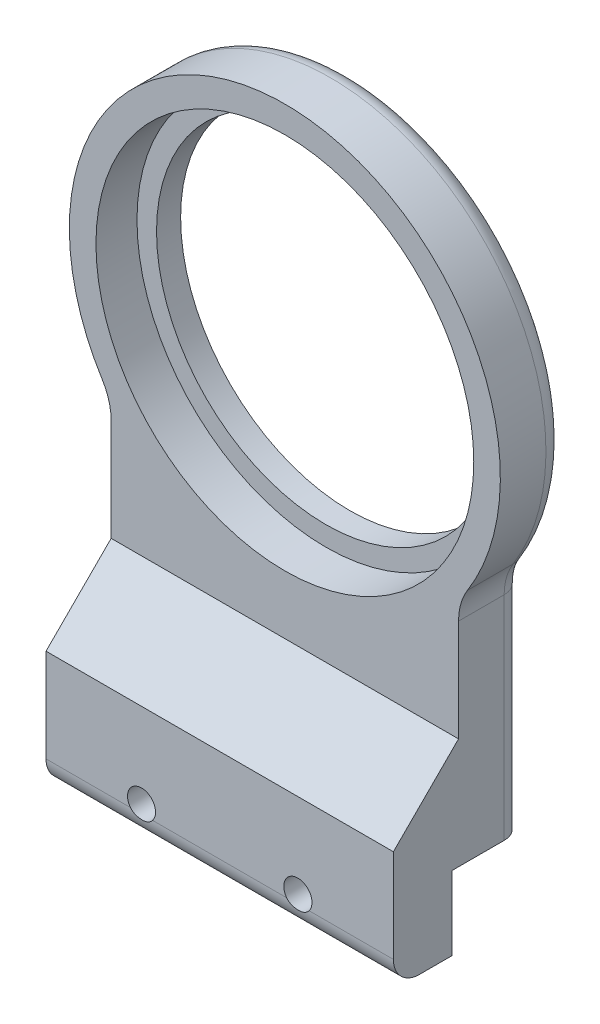
from build123d import *

# Parameters (mm, degrees)
SKETCH_1_R          = 26
EXTRUDE_1_DEPTH     = 10
SKETCH_3_R          = 29
CUT_EXTRUDE_1_DEPTH = 6.3
FILLET_1_R          = 9
SKETCH_4_W          = 53.328443722
SKETCH_4_H          = 11.316007496
EXTRUDE_2_DEPTH     = 10
SKETCH_5_W          = 53.328443722
SKETCH_5_H          = 11.316007496
EXTRUDE_3_DEPTH     = 2
SKETCH_6_W          = 53.328443722
SKETCH_6_H          = 10
EXTRUDE_4_DEPTH     = 3
CHAMFER_1_SIZE      = 14
FILLET_3_R          = 3
SKETCH_7_R          = 1.7
CUT_EXTRUDE_2_DEPTH = 14
SKETCH_8_R          = 2.15
SKETCH_8_R_2        = 2.165
CUT_EXTRUDE_3_DEPTH = 6
SKETCH_9_W          = 53.328443722
SKETCH_9_H          = 11.316007496
CUT_EXTRUDE_4_DEPTH = 3
FILLET_4_R          = 4


with BuildPart() as part:
    # 草图1 → 凸台-拉伸1 (new body)
    with BuildSketch(Plane.XY):
        with BuildLine():
            Line((26.664221861, -27.841996252), (-26.664221861, -27.841996252))
            Line((-26.664221861, -27.841996252), (-26.664221861, 7.574088737))
            ThreePointArc((-26.664221861, 7.574088737), (0, 60.241390131), (26.664221861, 7.574088737))
            Line((26.664221861, 7.574088737), (26.664221861, -27.841996252))
        make_face()
        with Locations((0, 27.158003748)):
            Circle(SKETCH_1_R, mode=Mode.SUBTRACT)
    extrude(amount=EXTRUDE_1_DEPTH)

    # 草图3 → 切除-拉伸1 (cut)
    with BuildSketch(Plane.XY.offset(10)):
        with Locations((0, 27.158003748)):
            Circle(SKETCH_3_R)
    extrude(amount=-CUT_EXTRUDE_1_DEPTH, mode=Mode.SUBTRACT)

    # 圆角1
    fillet_1_edges = [part.edges().sort_by_distance(p)[0] for p in [
        (-26.664221861, 7.574088737, 5),
        (26.664221861, 7.574088737, 5),
    ]]
    fillet(fillet_1_edges, radius=FILLET_1_R)



with BuildPart() as body_2:
    # 草图4 → 凸台-拉伸2 (new body)
    with BuildSketch(Plane.XY.offset(10)):
        with Locations((0, -33.5)):
            Rectangle(SKETCH_4_W, SKETCH_4_H)
    extrude(amount=EXTRUDE_2_DEPTH)


with BuildPart() as part_1:
    add(part.part)

    add(body_2.part)  # 凸台-拉伸3 merges body 2
    # 草图5 → 凸台-拉伸3 (add)
    with BuildSketch(Plane(origin=(0, 0, 10), x_dir=(-1, 0, 0), z_dir=(0, 0, -1))):
        with Locations((0, -33.5)):
            Rectangle(SKETCH_5_W, SKETCH_5_H)
    extrude(amount=EXTRUDE_3_DEPTH)

    # 草图6 → 凸台-拉伸4 (add)
    with BuildSketch(Plane(origin=(0, -27.841996252, 0), x_dir=(1, 0, 0), z_dir=(0, 1, 0))):
        with Locations((0, -15)):
            Rectangle(SKETCH_6_W, SKETCH_6_H)
    extrude(amount=EXTRUDE_4_DEPTH)

    # 倒角1
    # the kernel refuses this chamfer: 14 mm, written as the material it adds along each edge
    with BuildSketch(Plane(origin=(-26.664221861, -24.841996252, 10), x_dir=(0, -0.027495876610586365, 0.9996219169112968), z_dir=(1, 0, 0))) as chamfer_1_piece_1_section:
        Polygon((CHAMFER_1_SIZE * 0.999621916911, -CHAMFER_1_SIZE * 0.0274958766106), (-CHAMFER_1_SIZE * 0.0274958766106, -CHAMFER_1_SIZE * 0.999621916911), (0, 0), align=None)
    chamfer_1_piece_1 = extrude(amount=53.328443723, mode=Mode.PRIVATE)
    chamfer_1_piece_1 = split(chamfer_1_piece_1, bisect_by=Plane(origin=(0, -19.845516644, 20), z_dir=(0, 0, -1)), keep=Keep.TOP, mode=Mode.PRIVATE)
    add(chamfer_1_piece_1)

    # 圆角3
    fillet_3_edges = [part_1.edges().sort_by_distance(p)[0] for p in [
        (-26.664221861, -11.511986052, 0),
        (0, 60.241390131, 0),
        (-27.014230163, 7.303510743, 0),
        (27.014230163, 7.303510743, 0),
        (26.664221861, -11.511986052, 0),
    ]]
    fillet(fillet_3_edges, radius=FILLET_3_R)

    # 草图7 → 切除-拉伸2 (cut)
    with BuildSketch(Plane(origin=(0, 0, 8), x_dir=(-1, 0, 0), z_dir=(0, 0, -1))):
        with Locations((-12, -33.841996252)):
            Circle(SKETCH_7_R)
        with Locations((12, -33.841996252)):
            Circle(SKETCH_7_R)
    extrude(amount=-CUT_EXTRUDE_2_DEPTH, mode=Mode.SUBTRACT)

    # 草图8 → 切除-拉伸3 (cut)
    with BuildSketch(Plane.XY.offset(20)):
        with Locations((-12, -33.841996252)):
            Circle(SKETCH_8_R)
        with Locations((12, -33.841996252)):
            Circle(SKETCH_8_R_2)
    extrude(amount=-CUT_EXTRUDE_3_DEPTH, mode=Mode.SUBTRACT)

    # 草图9 → 切除-拉伸4 (cut)
    with BuildSketch(Plane(origin=(0, 0, 8), x_dir=(-1, 0, 0), z_dir=(0, 0, -1))):
        with Locations((0, -33.5)):
            Rectangle(SKETCH_9_W, SKETCH_9_H)
    extrude(amount=-CUT_EXTRUDE_4_DEPTH, mode=Mode.SUBTRACT)

    # 圆角4
    # the kernel refuses this fillet: 4 mm, written as the material it takes off along each edge
    with BuildSketch(Plane(origin=(36.664221861, -39.158003748, 20), x_dir=(0, 1, 0), z_dir=(-1, 0, 0))) as fillet_4_piece_1:
        with BuildLine():
            CenterArc((FILLET_4_R, FILLET_4_R), FILLET_4_R, 180, 90)
            Line((0, FILLET_4_R), (0, 0))
            Line((0, 0), (FILLET_4_R, 0))
        make_face()
    extrude(amount=73.328443723, mode=Mode.SUBTRACT)


solid = part_1.part
